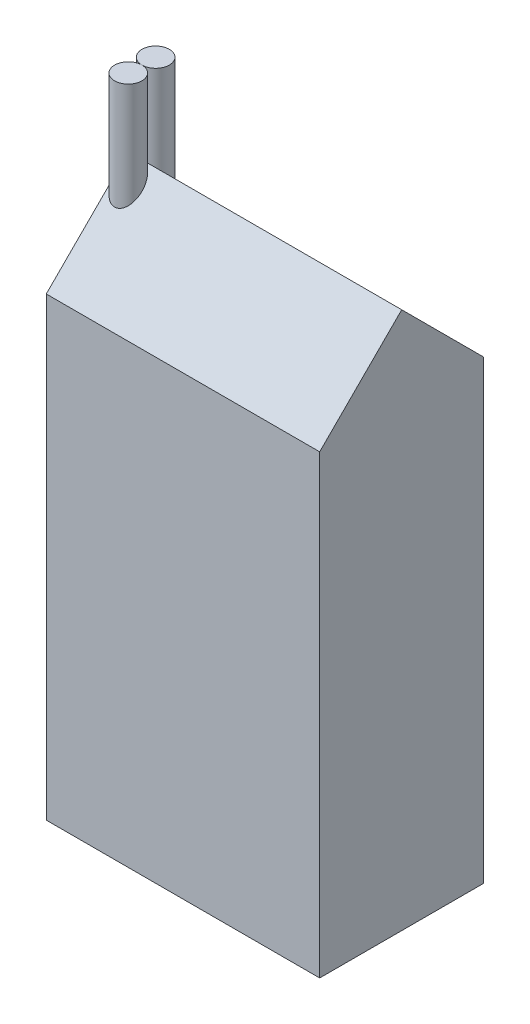
from build123d import *

# Parameters (mm, degrees)
CROQUIS1_W                = 30
CROQUIS1_H                = 60
SALIENTE_EXTRUIR1_DEPTH   = 9
CHAFL_N1_SIZE             = 10
CROQUIS2_R                = 1.5
SALIENTE_EXTRUIR4_DEPTH   = 38
SALIENTE_EXTRUIR4_2_DEPTH = 38


with BuildPart() as part:
    # Croquis1 → Saliente-Extruir1 (new, symmetric)
    with BuildSketch(Plane.XY):
        Rectangle(CROQUIS1_W, CROQUIS1_H)
    extrude(amount=SALIENTE_EXTRUIR1_DEPTH, both=True)

    # Chaflán1
    # the kernel refuses this chamfer: 10 mm, written as the material it takes off along each edge
    with BuildSketch(Plane(origin=(40.71682988, 30, -9), x_dir=(0, 0.027495876610586317, 0.9996219169112968), z_dir=(-1, 0, 0))) as chafl_n1_piece_1:
        Polygon((CHAFL_N1_SIZE * 0.999621916911, -CHAFL_N1_SIZE * 0.0274958766106), (-CHAFL_N1_SIZE * 0.0274958766106, -CHAFL_N1_SIZE * 0.999621916911), (0, 0), align=None)
    extrude(amount=81.433659759, mode=Mode.SUBTRACT)
    with BuildSketch(Plane(origin=(40.71682988, 30, 9), x_dir=(0, 0.027495876610586317, -0.9996219169112968), z_dir=(-1, 0, 0))) as chafl_n1_piece_2:
        Polygon((CHAFL_N1_SIZE * 0.999621916911, CHAFL_N1_SIZE * 0.0274958766106), (-CHAFL_N1_SIZE * 0.0274958766106, CHAFL_N1_SIZE * 0.999621916911), (0, 0), align=None)
    extrude(amount=81.433659759, mode=Mode.SUBTRACT)


with BuildPart() as body_2:
    # Croquis2 → Saliente-Extruir4 (new body)
    with BuildSketch(Plane(origin=(0, 0, 0), x_dir=(1, 0, 0), z_dir=(0, 1, 0))):
        with Locations(Location((-13.5, 1.5, 0), (0, 0, 270))):
            Circle(CROQUIS2_R)
    extrude(amount=SALIENTE_EXTRUIR4_DEPTH)


with BuildPart() as body_3:
    # Croquis2 → Saliente-Extruir4 2 (new body)
    with BuildSketch(Plane(origin=(0, 0, 0), x_dir=(1, 0, 0), z_dir=(0, 1, 0))):
        with Locations(Location((-13.5, -1.5, 0), (0, 0, 90))):
            Circle(CROQUIS2_R)
    extrude(amount=SALIENTE_EXTRUIR4_2_DEPTH)


solid = Compound([part.part, body_2.part, body_3.part])
